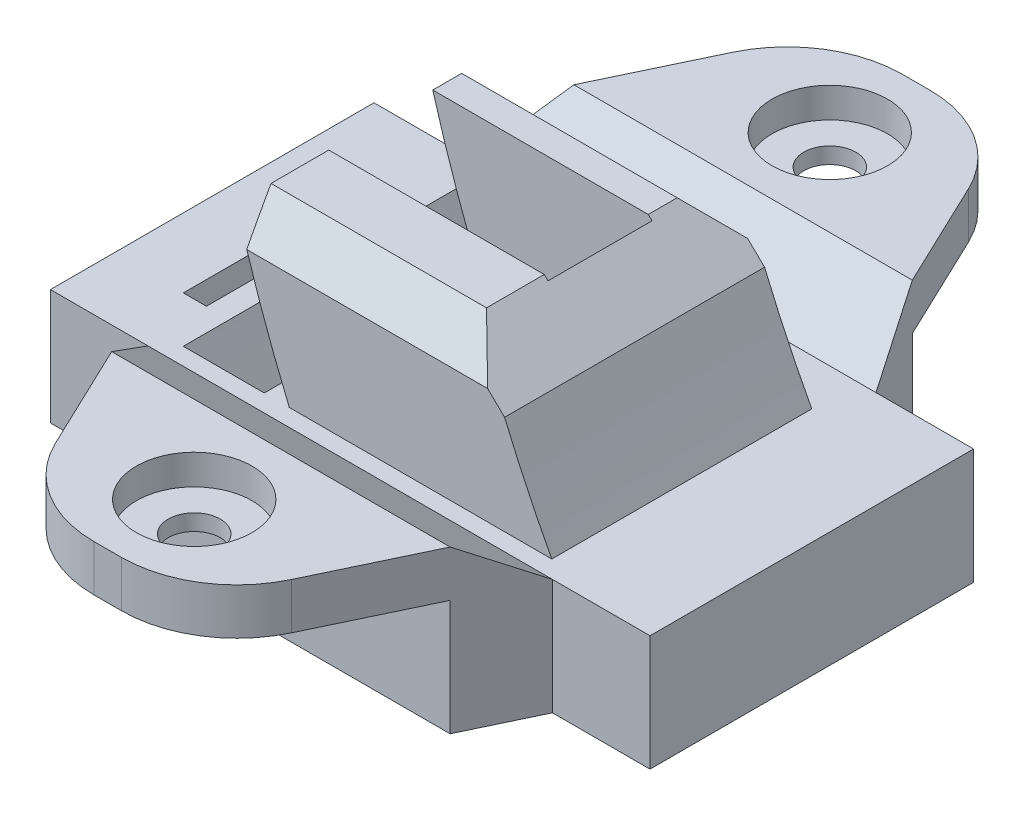
from build123d import *

# Parameters (mm, degrees)
SCHIZZO2_W                                           = 51.888116
SCHIZZO2_H                                           = 40
ESTRUSIONE_ESTRUSIONE2_DEPTH                         = 10
ESTRUSIONE_ESTRUSIONE3_DEPTH                         = 12.5
ESTRUSIONE_ESTRUSIONE3_DEPTH_BACK                    = 10
SCHIZZO3_R                                           = 113
SCHIZZO3_R_2                                         = 105
SCHIZZO3_R_3                                         = 95
SCHIZZO3_R_4                                         = 92.5
TAGLIO_ESTRUSIONE1_DEPTH                             = 4.5
TAGLIO_ESTRUSIONE1_DEPTH_BACK                        = 4.5
SCHIZZO3_3_R                                         = 115
SCHIZZO3_3_R_2                                       = 113
SCHIZZO3_3_R_3                                       = 105
SCHIZZO3_3_R_4                                       = 95
TAGLIO_ESTRUSIONE2_DEPTH                             = 12.5
TAGLIO_ESTRUSIONE2_DEPTH_BACK                        = 12.5
SCHIZZO3_4_R                                         = 121.5
SCHIZZO3_4_R_2                                       = 115
TAGLIO_ESTRUSIONE3_DEPTH                             = 79.5
TAGLIO_ESTRUSIONE3_DEPTH_BACK                        = 79.5
ESTRUSIONE_ESTRUSIONE5_DEPTH                         = 51.888111
FORO_LAMATO_PER_VITE_M4_A_TESTA_CILINDRI_D           = 4.5
FORO_LAMATO_PER_VITE_M4_A_TESTA_CILINDRI_DEPTH       = 30
FORO_LAMATO_PER_VITE_M4_A_TESTA_CILINDRI_CBORE_D     = 10
FORO_LAMATO_PER_VITE_M4_A_TESTA_CILINDRI_CBORE_DEPTH = 2.6
FORO_LAMATO_PER_VITE_M4_A_TESTA_CILINDRI_TIP         = 1.351936393
SCHIZZO10_W                                          = 2
SCHIZZO10_H                                          = 17
TAGLIO_ESTRUSIONE4_DEPTH                             = 10
TAGLIO_ESTRUSIONE5_DEPTH                             = 33
RACCORDO1_R                                          = 10


with BuildPart() as part:
    # Schizzo2 → Estrusione-Estrusione2 (new body)
    with BuildSketch(Plane(origin=(0, 0, 0), x_dir=(1, 0, 0), z_dir=(0, 1, 0))):
        with Locations((-97.308977, 0)):
            Rectangle(SCHIZZO2_W, SCHIZZO2_H)
    extrude(amount=-ESTRUSIONE_ESTRUSIONE2_DEPTH)

    # Schizzo3 → Estrusione-Estrusione3 (add, two sides: drawn at the far end of the back side and taken through both)
    # profile 1 of 3: a face of its own
    with BuildSketch(Plane.XY.offset(-ESTRUSIONE_ESTRUSIONE3_DEPTH_BACK)):
        with Locations((0, 44)):
            Circle(SCHIZZO3_R)
        with Locations((0, 44)):
            Circle(SCHIZZO3_R_2, mode=Mode.SUBTRACT)
    # profile 2 of 3: a face of its own
    with BuildSketch(Plane.XY.offset(-ESTRUSIONE_ESTRUSIONE3_DEPTH_BACK)):
        with Locations((0, 44)):
            Circle(SCHIZZO3_R_2)
        with Locations((0, 44)):
            Circle(SCHIZZO3_R_3, mode=Mode.SUBTRACT)
    # profile 3 of 3: a face of its own
    with BuildSketch(Plane.XY.offset(-ESTRUSIONE_ESTRUSIONE3_DEPTH_BACK)):
        with Locations((0, 44)):
            Circle(SCHIZZO3_R_3)
        with Locations((0, 44)):
            Circle(SCHIZZO3_R_4, mode=Mode.SUBTRACT)
    extrude(amount=ESTRUSIONE_ESTRUSIONE3_DEPTH + ESTRUSIONE_ESTRUSIONE3_DEPTH_BACK)

    # Schizzo3<3> → Taglio-Estrusione1 (cut, two sides: drawn at the far end of the back side and taken through both)
    # profile 1 of 3: a face of its own
    with BuildSketch(Plane.XY.offset(-TAGLIO_ESTRUSIONE1_DEPTH_BACK)):
        with Locations((0, 44)):
            Circle(SCHIZZO3_3_R)
        with Locations((0, 44)):
            Circle(SCHIZZO3_3_R_2, mode=Mode.SUBTRACT)
    # profile 2 of 3: a face of its own
    with BuildSketch(Plane.XY.offset(-TAGLIO_ESTRUSIONE1_DEPTH_BACK)):
        with Locations((0, 44)):
            Circle(SCHIZZO3_3_R_2)
        with Locations((0, 44)):
            Circle(SCHIZZO3_3_R_3, mode=Mode.SUBTRACT)
    # profile 3 of 3: a face of its own
    with BuildSketch(Plane.XY.offset(-TAGLIO_ESTRUSIONE1_DEPTH_BACK)):
        with Locations((0, 44)):
            Circle(SCHIZZO3_3_R_3)
        with Locations((0, 44)):
            Circle(SCHIZZO3_3_R_4, mode=Mode.SUBTRACT)
    extrude(amount=TAGLIO_ESTRUSIONE1_DEPTH + TAGLIO_ESTRUSIONE1_DEPTH_BACK, mode=Mode.SUBTRACT)

    # Schizzo3<4> → Taglio-Estrusione2 (cut, two sides: drawn at the far end of the back side and taken through both)
    with BuildSketch(Plane.XY.offset(-TAGLIO_ESTRUSIONE2_DEPTH_BACK)):
        with Locations((0, 44)):
            Circle(SCHIZZO3_4_R)
        with Locations((0, 44)):
            Circle(SCHIZZO3_4_R_2, mode=Mode.SUBTRACT)
    extrude(amount=TAGLIO_ESTRUSIONE2_DEPTH + TAGLIO_ESTRUSIONE2_DEPTH_BACK, mode=Mode.SUBTRACT)

    # Schizzo4 → Taglio-Estrusione3 (cut, two sides: drawn at the far end of the back side and taken through both)
    with BuildSketch(Plane.XY.offset(12.5).offset(-TAGLIO_ESTRUSIONE3_DEPTH_BACK)):
        Polygon((150, 13), (150, -10), (150, -80), (-150, -80), (-150, -10), (0, -10), (0, 13), (-150, 13), (-150, 163), (150, 163), align=None)
    extrude(amount=TAGLIO_ESTRUSIONE3_DEPTH + TAGLIO_ESTRUSIONE3_DEPTH_BACK, mode=Mode.SUBTRACT)

    # Smusso1
    # the kernel refuses this chamfer: 4.942054941, 3 mm, written as the material it takes off along each edge
    with BuildSketch(Plane(origin=(-87.150731494, 13, 24.790313744), x_dir=(-0.998955732576957, 0.045688558213574655, 0), z_dir=(0, 0, -1))) as smusso1_piece_1:
        with BuildLine():
            Line((3.009603279, 0), (-2.049272113, -4.468643386))
            Line((-2.049272113, -4.468643386), (-2.138755111, -4.426662964))
            ThreePointArc((-2.138755111, -4.426662964), (-1.049342002, -2.223465239), (-0.091514438, 0.037345286))
            Line((-0.091514438, 0.037345286), (0.004515907, 0.098737882))
            ThreePointArc((0.004515907, 0.098737882), (1.506176357, 0.030057461), (3.014119187, 0.098737882))
            Line((3.014119187, 0.098737882), (3.009603279, 0))
        make_face()
    extrude(amount=47.080627488, mode=Mode.SUBTRACT)
    # the kernel refuses this chamfer: 4.942054941, 3 mm, written as the material it takes off along each edge
    with BuildSketch(Plane(origin=(-116.379670622, 13, -10), x_dir=(0, -0.9996219169112969, -0.02749587661058621), z_dir=(1, 0, 0))) as smusso1_2_piece_1:
        with BuildLine():
            Line((3.086019586, 0), (-0.169641465, -3.081353381))
            Line((-0.169641465, -3.081353381), (-0.22961878, -3.079703628))
            ThreePointArc((-0.22961878, -3.079703628), (-0.102387681, -1.540193489), (-0.059977315, 0.001649753))
            Line((-0.059977315, 0.001649753), (0.001649753, 0.059977315))
            ThreePointArc((0.001649753, 0.059977315), (1.543492994, 0.017566949), (3.087669338, 0.059977315))
            Line((3.087669338, 0.059977315), (3.086019586, 0))
        make_face()
    extrude(amount=34.07955152, mode=Mode.SUBTRACT)
    with BuildSketch(Plane(origin=(-116.379670622, 13, 12.5), x_dir=(0, -0.9996219169112969, 0.02749587661058621), z_dir=(1, 0, 0))) as smusso1_2_piece_2:
        with BuildLine():
            Line((3.086019586, 0), (-0.169641465, 3.081353381))
            Line((-0.169641465, 3.081353381), (-0.22961878, 3.079703628))
            ThreePointArc((-0.22961878, 3.079703628), (-0.102387681, 1.540193489), (-0.059977315, -0.001649753))
            Line((-0.059977315, -0.001649753), (0.001649753, -0.059977315))
            ThreePointArc((0.001649753, -0.059977315), (1.543492994, -0.017566949), (3.087669338, -0.059977315))
            Line((3.087669338, -0.059977315), (3.086019586, 0))
        make_face()
    extrude(amount=34.07955152, mode=Mode.SUBTRACT)

    # Schizzo7 → Estrusione-Estrusione5 (add)
    with BuildSketch(Plane(origin=(-71.364919, 0, 0), x_dir=(0, 0, -1), z_dir=(1, 0, 0))):
        Polygon((-20, 0), (-35, 0), (-35, 4), (-20, 4), (-14, 0), align=None)
        Polygon((20, 4), (35, 4), (35, 0), (20, 0), (14, 0), align=None)
    extrude(amount=-ESTRUSIONE_ESTRUSIONE5_DEPTH)

    # Foro lamato per Vite M4 a testa cilindrica piana-1
    with Locations(Plane(origin=(0, 4, 0), x_dir=(1, 0, 0), z_dir=(0, 1, 0))):
        with Locations((-97.308977, -27.5), (-97.308977, 27.5)):
            CounterBoreHole(FORO_LAMATO_PER_VITE_M4_A_TESTA_CILINDRI_D / 2, FORO_LAMATO_PER_VITE_M4_A_TESTA_CILINDRI_CBORE_D / 2, FORO_LAMATO_PER_VITE_M4_A_TESTA_CILINDRI_CBORE_DEPTH, depth=FORO_LAMATO_PER_VITE_M4_A_TESTA_CILINDRI_DEPTH)
            with Locations((0, 0, -(FORO_LAMATO_PER_VITE_M4_A_TESTA_CILINDRI_DEPTH + FORO_LAMATO_PER_VITE_M4_A_TESTA_CILINDRI_TIP / 2))):  # 118° drill point
                Cone(0, FORO_LAMATO_PER_VITE_M4_A_TESTA_CILINDRI_D / 2, FORO_LAMATO_PER_VITE_M4_A_TESTA_CILINDRI_TIP, mode=Mode.SUBTRACT)

    # Schizzo10 → Taglio-Estrusione4 (cut)
    with BuildSketch(Plane(origin=(0, 0, 0), x_dir=(1, 0, 0), z_dir=(0, 1, 0))):
        with Locations((-116.253035279, 0)):
            Rectangle(SCHIZZO10_W, SCHIZZO10_H)
    extrude(amount=-TAGLIO_ESTRUSIONE4_DEPTH, mode=Mode.SUBTRACT)

    # Schizzo11 → Taglio-Estrusione5 (cut)
    with BuildSketch(Plane(origin=(0, 4, 0), x_dir=(1, 0, 0), z_dir=(0, 1, 0))):
        Polygon((-123.253035, 14), (-123.253035, 35), (-104.808977, 35), (-114.808977, 14), align=None)
        Polygon((-89.808977, 35), (-71.364919, 35), (-71.364919, 14), (-79.808977, 14), align=None)
        Polygon((-123.253035, -14), (-123.253035, -35), (-104.808977, -35), (-114.808977, -14), align=None)
        Polygon((-89.808977, -35), (-71.364919, -35), (-71.364919, -14), (-79.808977, -14), align=None)
    extrude(amount=-TAGLIO_ESTRUSIONE5_DEPTH, mode=Mode.SUBTRACT)

    # Raccordo1
    raccordo1_edges = [part.edges().sort_by_distance(p)[0] for p in [
        (-104.808977, 2, -35),
        (-89.808977, 2, -35),
        (-104.808977, 2, 35),
        (-89.808977, 2, 35),
    ]]
    fillet(raccordo1_edges, radius=RACCORDO1_R)


solid = part.part
